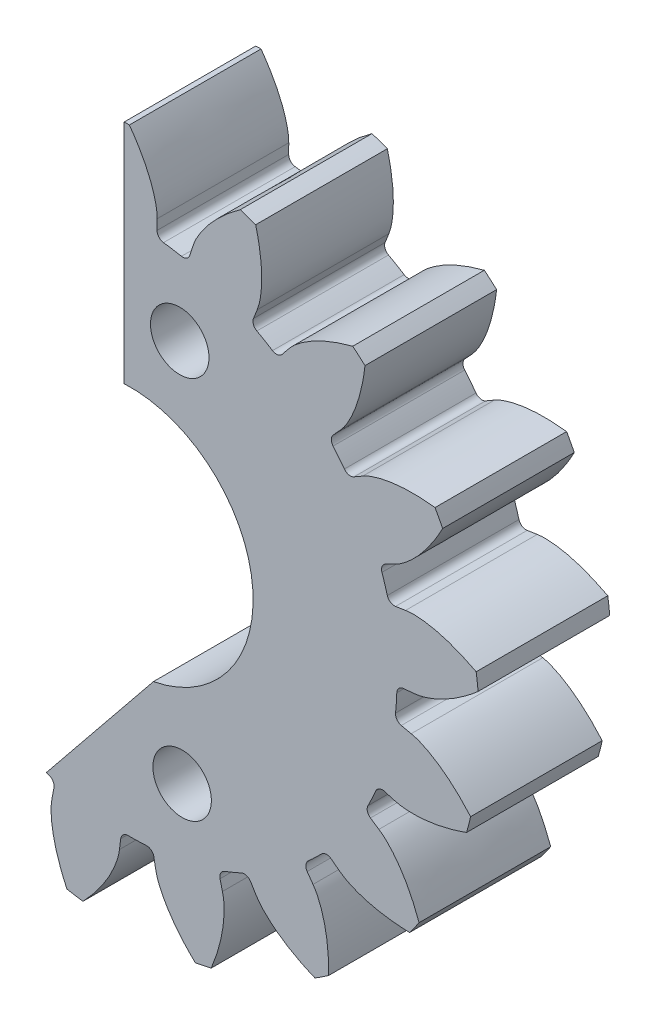
from build123d import *

# Parameters (mm, degrees)
SKETCH1_R           = 1.5
BOSS_EXTRUDE1_DEPTH = 4.5
CUT_EXTRUDE1_DEPTH  = 18.474286306
SKETCH5_R           = 1
CUT_EXTRUDE2_DEPTH  = 18.44524279


with BuildPart() as part:
    # Sketch1 → Boss-Extrude1 (new body)
    with BuildSketch(Plane.XY):
        with BuildLine():
            Line((2.142690816, 9.446385822), (2.036760212, 9.116523343))
            ThreePointArc((2.036760212, 9.116523343), (1.925215556, 8.976884922), (1.749077663, 8.946610489))
            ThreePointArc((1.749077663, 8.946610489), (1.443445404, 9.000976463), (1.136139278, 9.044904613))
            ThreePointArc((1.136139278, 9.044904613), (0.978300237, 9.128737399), (0.916012393, 9.296252542))
            Line((0.916012393, 9.296252542), (0.918538131, 9.642697586))
            add(Edge.make_bspline(
                [(0.918538131, 9.642697586), (0.920074647, 9.853455045), (0.756738592, 10.686258414), (0.336577813, 11.434986659), (-0.030409782, 11.94504001)],
                knots=[0, 0, 0, 0, 0.250058326, 1, 1, 1, 1], degree=3))
            ThreePointArc((-0.030409782, 11.94504001), (-0.308005832, 11.941107068), (-0.585435504, 11.93072382))
            add(Edge.make_bspline(
                [(-0.585435504, 11.93072382), (-0.924729077, 11.407724954), (-1.308534817, 10.639195503), (-1.429406641, 9.798416791), (-1.414428472, 9.582521648)],
                knots=[-0.008484668, -0.008484668, -0.008484668, -0.008484668, 0.741457006, 1, 1, 1, 1], degree=3))
            Line((-1.414428472, 9.582521648), (-1.394045746, 9.236667499))
            ThreePointArc((-1.394045746, 9.236667499), (-1.447614825, 9.066163972), (-1.600922132, 8.974305558))
            ThreePointArc((-1.600922132, 8.974305558), (-1.905554981, 8.914593212), (-2.207978087, 8.844543215))
            ThreePointArc((-2.207978087, 8.844543215), (-2.385442505, 8.865696922), (-2.50403764, 8.999399176))
            Line((-2.50403764, 8.999399176), (-2.626832843, 9.32336196))
            add(Edge.make_bspline(
                [(-2.626832843, 9.32336196), (-2.701534461, 9.520442492), (-3.154684073, 10.238004717), (-3.81694417, 10.784393433), (-4.343402434, 11.127432808)],
                knots=[0, 0, 0, 0, 0.250058326, 1, 1, 1, 1], degree=3))
            ThreePointArc((-4.343402434, 11.127432808), (-4.600832298, 11.023486189), (-4.855776901, 10.913584942))
            add(Edge.make_bspline(
                [(-4.855776901, 10.913584942), (-4.983229754, 10.303336047), (-5.063493088, 9.448057053), (-4.872478404, 8.620390313), (-4.780521357, 8.424484826)],
                knots=[-0.008484668, -0.008484668, -0.008484668, -0.008484668, 0.741457006, 1, 1, 1, 1], degree=3))
            Line((-4.780521357, 8.424484826), (-4.636578102, 8.109348527))
            ThreePointArc((-4.636578102, 8.109348527), (-4.624936802, 7.93100734), (-4.734708522, 7.789970933))
            ThreePointArc((-4.734708522, 7.789970933), (-4.997199607, 7.62424475), (-5.253895777, 7.449677247))
            ThreePointArc((-5.253895777, 7.449677247), (-5.427018018, 7.405294949), (-5.585903513, 7.487127083))
            Line((-5.585903513, 7.487127083), (-5.817435487, 7.74485464))
            add(Edge.make_bspline(
                [(-5.817435487, 7.74485464), (-5.95828637, 7.901641426), (-6.640049173, 8.407051753), (-7.454966693, 8.677308116), (-8.069794519, 8.807004146)],
                knots=[0, 0, 0, 0, 0.250058326, 1, 1, 1, 1], degree=3))
            ThreePointArc((-8.069794519, 8.807004146), (-8.272290869, 8.617082417), (-8.470318721, 8.422505943))
            add(Edge.make_bspline(
                [(-8.470318721, 8.422505943), (-8.368717639, 7.807424515), (-8.13459856, 6.980906144), (-7.65749496, 6.278132356), (-7.500978342, 6.128674647)],
                knots=[-0.008484668, -0.008484668, -0.008484668, -0.008484668, 0.741457006, 1, 1, 1, 1], degree=3))
            Line((-7.500978342, 6.128674647), (-7.252914893, 5.886817101))
            ThreePointArc((-7.252914893, 5.886817101), (-7.177635437, 5.724724219), (-7.22904629, 5.553557567))
            ThreePointArc((-7.22904629, 5.553557567), (-7.413944735, 5.304199787), (-7.59024573, 5.048691086))
            ThreePointArc((-7.59024573, 5.048691086), (-7.735644677, 4.944766859), (-7.913362165, 4.963676991))
            Line((-7.913362165, 4.963676991), (-8.222361232, 5.120361784))
            add(Edge.make_bspline(
                [(-8.222361232, 5.120361784), (-8.410338689, 5.2156799), (-9.228638839, 5.440679864), (-10.086154654, 5.398304255), (-10.706316137, 5.297140773)],
                knots=[0, 0, 0, 0, 0.250058326, 1, 1, 1, 1], degree=3))
            ThreePointArc((-10.706316137, 5.297140773), (-10.826530719, 5.046893916), (-10.940897062, 4.793920846))
            add(Edge.make_bspline(
                [(-10.940897062, 4.793920846), (-10.623963835, 4.25707704), (-10.107081422, 3.570945177), (-9.40832439, 3.087977836), (-9.208386639, 3.005152997)],
                knots=[-0.008484668, -0.008484668, -0.008484668, -0.008484668, 0.741457006, 1, 1, 1, 1], degree=3))
            Line((-9.208386639, 3.005152997), (-8.889705338, 2.869238405))
            ThreePointArc((-8.889705338, 2.869238405), (-8.760954633, 2.745285371), (-8.7470613, 2.567105479))
            ThreePointArc((-8.7470613, 2.567105479), (-8.829395545, 2.267793252), (-8.901490937, 1.965851218))
            ThreePointArc((-8.901490937, 1.965851218), (-8.999529656, 1.816420605), (-9.172077407, 1.769854816))
            Line((-9.172077407, 1.769854816), (-9.516811531, 1.804335697))
            add(Edge.make_bspline(
                [(-9.516811531, 1.804335697), (-9.726528165, 1.825311903), (-10.570849691, 1.739514011), (-11.35515154, 1.390229491), (-11.896890436, 1.071869186)],
                knots=[0, 0, 0, 0, 0.250058326, 1, 1, 1, 1], degree=3))
            ThreePointArc((-11.896890436, 1.071869186), (-11.918587603, 0.795094426), (-11.933846629, 0.517890175))
            add(Edge.make_bspline(
                [(-11.933846629, 0.517890175), (-11.444384845, 0.131787721), (-10.714546932, -0.321291723), (-9.888507478, -0.519225201), (-9.672151294, -0.524231217)],
                knots=[-0.008484668, -0.008484668, -0.008484668, -0.008484668, 0.741457006, 1, 1, 1, 1], degree=3))
            Line((-9.672151294, -0.524231217), (-9.325891817, -0.535846836))
            ThreePointArc((-9.325891817, -0.535846836), (-9.16105836, -0.604919479), (-9.083737211, -0.766048429))
            ThreePointArc((-9.083737211, -0.766048429), (-9.052387561, -1.074891329), (-9.010540469, -1.382487749))
            ThreePointArc((-9.010540469, -1.382487749), (-9.047978288, -1.557243317), (-9.19205277, -1.662996058))
            Line((-9.19205277, -1.662996058), (-9.525963699, -1.755375925))
            add(Edge.make_bspline(
                [(-9.525963699, -1.755375925), (-9.729096116, -1.811574581), (-10.485408718, -2.196582847), (-11.090572289, -2.805603469), (-11.480723759, -3.298164274)],
                knots=[0, 0, 0, 0, 0.250058326, 1, 1, 1, 1], degree=3))
            ThreePointArc((-11.480723759, -3.298164274), (-11.400973189, -3.564086973), (-11.315064081, -3.828084435))
            add(Edge.make_bspline(
                [(-11.315064081, -3.828084435), (-10.719178266, -4.01130026), (-9.874953507, -4.170136395), (-9.033192836, -4.056303998), (-8.829638322, -3.982815101)],
                knots=[-0.008484668, -0.008484668, -0.008484668, -0.008484668, 0.741457006, 1, 1, 1, 1], degree=3))
            Line((-8.829638322, -3.982815101), (-8.50256493, -3.868562992))
            ThreePointArc((-8.50256493, -3.868562992), (-8.323910392, -3.873426601), (-8.193604078, -3.995743252))
            ThreePointArc((-8.193604078, -3.995743252), (-8.052804476, -4.272405879), (-7.902666581, -4.544114086))
            ThreePointArc((-7.902666581, -4.544114086), (-7.874447315, -4.7205929), (-7.970590473, -4.8712501))
            Line((-7.970590473, -4.8712501), (-8.248581684, -5.078014301))
            add(Edge.make_bspline(
                [(-8.248581684, -5.078014301), (-8.417695725, -5.20379788), (-8.983855196, -5.836019021), (-9.328149796, -6.622524135), (-9.514021721, -7.222762373)],
                knots=[0, 0, 0, 0, 0.250058326, 1, 1, 1, 1], degree=3))
            ThreePointArc((-9.514021721, -7.222762373), (-9.34359417, -7.441918676), (-9.16811943, -7.657055029))
            add(Edge.make_bspline(
                [(-9.16811943, -7.657055029), (-8.546287266, -7.612639914), (-7.701692893, -7.45578104), (-6.957895448, -7.045556464), (-6.794633768, -6.903497736)],
                knots=[-0.008484668, -0.008484668, -0.008484668, -0.008484668, 0.741457006, 1, 1, 1, 1], degree=3))
            Line((-6.794633768, -6.903497736), (-6.530919535, -6.678808281))
            ThreePointArc((-6.530919535, -6.678808281), (-6.362572202, -6.618805997), (-6.196879311, -6.685790808))
            ThreePointArc((-6.196879311, -6.685790808), (-5.965645524, -6.892908341), (-5.727493781, -7.092032636))
            ThreePointArc((-5.727493781, -7.092032636), (-5.637428599, -7.246400254), (-5.672655765, -7.421614824))
            Line((-5.672655765, -7.421614824), (-5.857183005, -7.714838707))
            add(Edge.make_bspline(
                [(-5.857183005, -7.714838707), (-5.969438883, -7.893219439), (-6.268982248, -8.687268487), (-6.305908984, -9.545036219), (-6.26239833, -10.171886391)],
                knots=[0, 0, 0, 0, 0.250058326, 1, 1, 1, 1], degree=3))
            ThreePointArc((-6.26239833, -10.171886391), (-6.024310985, -10.314678025), (-5.782969448, -10.451897912))
            add(Edge.make_bspline(
                [(-5.782969448, -10.451897912), (-5.219172814, -10.185850364), (-4.488275976, -9.734481141), (-3.942895724, -9.083267488), (-3.841976273, -8.891824748)],
                knots=[-0.008484668, -0.008484668, -0.008484668, -0.008484668, 0.741457006, 1, 1, 1, 1], degree=3))
            Line((-3.841976273, -8.891824748), (-3.677237268, -8.587043502))
            ThreePointArc((-3.677237268, -8.587043502), (-3.541933379, -8.470278967), (-3.363231656, -8.472885267))
            ThreePointArc((-3.363231656, -8.472885267), (-3.072793087, -8.582485337), (-2.778791209, -8.682132879))
            ThreePointArc((-2.778791209, -8.682132879), (-2.639043912, -8.7935411), (-2.608597463, -8.969649341))
            Line((-2.608597463, -8.969649341), (-2.674739306, -9.309731396))
            add(Edge.make_bspline(
                [(-2.674739306, -9.309731396), (-2.714976241, -9.516617976), (-2.70744851, -10.365254206), (-2.432020221, -11.178438271), (-2.165003344, -11.747240788)],
                knots=[0, 0, 0, 0, 0.250058326, 1, 1, 1, 1], degree=3))
            ThreePointArc((-2.165003344, -11.747240788), (-1.891411218, -11.794382951), (-1.616797397, -11.835154067))
            add(Edge.make_bspline(
                [(-1.616797397, -11.835154067), (-1.187180152, -11.38340528), (-0.668692519, -10.698485624), (-0.395386084, -9.894232906), (-0.370438593, -9.679261556)],
                knots=[-0.008484668, -0.008484668, -0.008484668, -0.008484668, 0.741457006, 1, 1, 1, 1], degree=3))
            Line((-0.370438593, -9.679261556), (-0.326923731, -9.335550916))
            ThreePointArc((-0.326923731, -9.335550916), (-0.242936827, -9.177793828), (-0.075360929, -9.115669622))
            ThreePointArc((-0.075360929, -9.115669622), (0.235057082, -9.112950131), (0.545202514, -9.099662968))
            ThreePointArc((0.545202514, -9.099662968), (0.715758279, -9.153065494), (0.807766381, -9.306283012))
            Line((0.807766381, -9.306283012), (0.868942758, -9.647293274))
            add(Edge.make_bspline(
                [(0.868942758, -9.647293274), (0.906158986, -9.854744521), (1.219741152, -10.643354909), (1.770326349, -11.302130292), (2.22478734, -11.736065222)],
                knots=[0, 0, 0, 0, 0.250058326, 1, 1, 1, 1], degree=3))
            ThreePointArc((2.22478734, -11.736065222), (2.496934113, -11.681191105), (2.767732101, -11.620007083))
            add(Edge.make_bspline(
                [(2.767732101, -11.620007083), (3.005147767, -11.043568236), (3.241201568, -10.217600341), (3.205522637, -9.368927344), (3.151128871, -9.159460457)],
                knots=[-0.008484668, -0.008484668, -0.008484668, -0.008484668, 0.741457006, 1, 1, 1, 1], degree=3))
            Line((3.151128871, -9.159460457), (3.067542667, -8.823240448))
            ThreePointArc((3.067542667, -8.823240448), (3.08886969, -8.645796776), (3.222687709, -8.527332282))
            ThreePointArc((3.222687709, -8.527332282), (3.511161491, -8.412660513), (3.795563616, -8.288233151))
            ThreePointArc((3.795563616, -8.288233151), (3.973893348, -8.276417674), (4.115036899, -8.386051594))
            Line((4.115036899, -8.386051594), (4.295269287, -8.681934737))
            add(Edge.make_bspline(
                [(4.295269287, -8.681934737), (4.40491242, -8.861933212), (4.982198012, -9.484011554), (5.733580536, -9.899406991), (6.314108166, -10.139869016)],
                knots=[0, 0, 0, 0, 0.250058326, 1, 1, 1, 1], degree=3))
            ThreePointArc((6.314108166, -10.139869016), (6.548054657, -9.990389672), (6.778464043, -9.835513755))
            add(Edge.make_bspline(
                [(6.778464043, -9.835513755), (6.791613828, -9.212236107), (6.713353424, -8.356771514), (6.373507764, -7.578296229), (6.247118921, -7.402623469)],
                knots=[-0.008484668, -0.008484668, -0.008484668, -0.008484668, 0.741457006, 1, 1, 1, 1], degree=3))
            Line((6.247118921, -7.402623469), (6.047720431, -7.119302467))
            ThreePointArc((6.047720431, -7.119302467), (6.003507239, -6.946136961), (6.085494515, -6.787331466))
            ThreePointArc((6.085494515, -6.787331466), (6.313064084, -6.576194476), (6.53331282, -6.357431519))
            ThreePointArc((6.53331282, -6.357431519), (6.6953321, -6.281993786), (6.866548882, -6.33323744))
            Line((6.866548882, -6.33323744), (7.141495898, -6.544032806))
            add(Edge.make_bspline(
                [(7.141495898, -6.544032806), (7.308758024, -6.672268717), (8.071781424, -7.043799887), (8.9224829, -7.159713921), (9.550673697, -7.174227313)],
                knots=[0, 0, 0, 0, 0.250058326, 1, 1, 1, 1], degree=3))
            ThreePointArc((9.550673697, -7.174227313), (9.714824136, -6.950330756), (9.873726855, -6.722679793))
            add(Edge.make_bspline(
                [(9.873726855, -6.722679793), (9.660834808, -6.136740445), (9.278829699, -5.367314387), (8.68071535, -4.764174216), (8.499400943, -4.646021162)],
                knots=[-0.008484668, -0.008484668, -0.008484668, -0.008484668, 0.741457006, 1, 1, 1, 1], degree=3))
            Line((8.499400943, -4.646021162), (8.211120038, -4.453863238))
            ThreePointArc((8.211120038, -4.453863238), (8.107337868, -4.30836286), (8.126421565, -4.130663926))
            ThreePointArc((8.126421565, -4.130663926), (8.262352391, -3.851576936), (8.388701925, -3.568023533))
            ThreePointArc((8.388701925, -3.568023533), (8.512529152, -3.439151827), (8.69069539, -3.425084476))
            Line((8.69069539, -3.425084476), (9.023223916, -3.522322983))
            add(Edge.make_bspline(
                [(9.023223916, -3.522322983), (9.225515358, -3.58147736), (10.071226027, -3.652284013), (10.906354508, -3.453061812), (11.497367823, -3.239666457)],
                knots=[0, 0, 0, 0, 0.250058326, 1, 1, 1, 1], degree=3))
            ThreePointArc((11.497367823, -3.239666457), (11.569552783, -2.971591157), (11.635488142, -2.701910674))
            add(Edge.make_bspline(
                [(11.635488142, -2.701910674), (11.225306515, -2.232443981), (10.591148608, -1.652971712), (9.815544227, -1.306624075), (9.603791772, -1.261947952)],
                knots=[-0.008484668, -0.008484668, -0.008484668, -0.008484668, 0.741457006, 1, 1, 1, 1], degree=3))
            Line((9.603791772, -1.261947952), (9.265562385, -1.186905099))
            ThreePointArc((9.265562385, -1.186905099), (9.116227595, -1.088720481), (9.069830353, -0.916127333))
            ThreePointArc((9.069830353, -0.916127333), (9.095764224, -0.606782588), (9.111150352, -0.296734198))
            ThreePointArc((9.111150352, -0.296734198), (9.180061972, -0.131833357), (9.341115328, -0.054354874))
            Line((9.341115328, -0.054354874), (9.686315544, -0.024903923))
            add(Edge.make_bspline(
                [(9.686315544, -0.024903923), (9.896315722, -0.006987639), (10.710495748, 0.232493054), (11.417262505, 0.719945428), (11.891278715, 1.132429305)],
                knots=[0, 0, 0, 0, 0.250058326, 1, 1, 1, 1], degree=3))
            ThreePointArc((11.891278715, 1.132429305), (11.861749218, 1.408478293), (11.825812282, 1.683766454))
            add(Edge.make_bspline(
                [(11.825812282, 1.683766454), (11.273738375, 1.973356413), (10.47307421, 2.284613953), (9.624729466, 2.327392886), (9.411137305, 2.292558321)],
                knots=[-0.008484668, -0.008484668, -0.008484668, -0.008484668, 0.741457006, 1, 1, 1, 1], degree=3))
            Line((9.411137305, 2.292558321), (9.068639189, 2.24035115))
            ThreePointArc((9.068639189, 2.24035115), (8.89392027, 2.277959631), (8.788308294, 2.422137332))
            ThreePointArc((8.788308294, 2.422137332), (8.700742697, 2.719961111), (8.603087437, 3.014630735))
            ThreePointArc((8.603087437, 3.014630735), (8.607776555, 3.193289938), (8.72996588, 3.323715655))
            Line((8.72996588, 3.323715655), (9.041216585, 3.47587855))
            add(Edge.make_bspline(
                [(9.041216585, 3.47587855), (9.23056381, 3.568445801), (9.90325367, 4.085870646), (10.386205936, 4.795720049), (10.679206525, 5.351584215)],
                knots=[0, 0, 0, 0, 0.250058326, 1, 1, 1, 1], degree=3))
            ThreePointArc((10.679206525, 5.351584215), (10.551950692, 5.598324945), (10.418994944, 5.842041592))
            add(Edge.make_bspline(
                [(10.418994944, 5.842041592), (9.799589398, 5.912644088), (8.940553107, 5.913649844), (8.134041659, 5.647082543), (7.947456596, 5.537441889)],
                knots=[-0.008484668, -0.008484668, -0.008484668, -0.008484668, 0.741457006, 1, 1, 1, 1], degree=3))
            Line((7.947456596, 5.537441889), (7.64694602, 5.365035562))
            ThreePointArc((7.64694602, 5.365035562), (7.470439729, 5.336988673), (7.319876502, 5.433278929))
            ThreePointArc((7.319876502, 5.433278929), (7.130637656, 5.67935899), (6.933129893, 5.918853082))
            ThreePointArc((6.933129893, 5.918853082), (6.872963217, 6.087141733), (6.939786166, 6.252899967))
            Line((6.939786166, 6.252899967), (7.175051226, 6.507224364))
            add(Edge.make_bspline(
                [(7.175051226, 6.507224364), (7.318173108, 6.661940862), (7.758522308, 7.387428767), (7.952434703, 8.223806103), (8.024848318, 8.847978022)],
                knots=[0, 0, 0, 0, 0.250058326, 1, 1, 1, 1], degree=3))
            ThreePointArc((8.024848318, 8.847978022), (7.817052756, 9.032086792), (7.605034605, 9.211316641))
            add(Edge.make_bspline(
                [(7.605034605, 9.211316641), (7.001951571, 9.053396417), (6.200560765, 8.744014555), (5.544806453, 8.20410241), (5.410427836, 8.034463247)],
                knots=[-0.008484668, -0.008484668, -0.008484668, -0.008484668, 0.741457006, 1, 1, 1, 1], degree=3))
            Line((5.410427836, 8.034463247), (5.192490418, 7.765142193))
            ThreePointArc((5.192490418, 7.765142193), (5.038034908, 7.675227821), (4.862854828, 7.710626099))
            ThreePointArc((4.862854828, 7.710626099), (4.597500488, 7.871727967), (4.326814738, 8.023701524))
            ThreePointArc((4.326814738, 8.023701524), (4.209918111, 8.158891306), (4.212349875, 8.33759549))
            Line((4.212349875, 8.33759549), (4.339855442, 8.65973347))
            add(Edge.make_bspline(
                [(4.339855442, 8.65973347), (4.417422576, 8.855703895), (4.565959517, 9.691273698), (4.444643097, 10.541221574), (4.286689878, 11.149403369)],
                knots=[0, 0, 0, 0, 0.250058326, 1, 1, 1, 1], degree=3))
            ThreePointArc((4.286689878, 11.149403369), (4.026418528, 11.246015269), (3.763972202, 11.336552336))
            add(Edge.make_bspline(
                [(3.763972202, 11.336552336), (3.258661385, 10.971437393), (2.623148333, 10.393451648), (2.206714411, 9.653112786), (2.142690816, 9.446385822)],
                knots=[-0.008484668, -0.008484668, -0.008484668, -0.008484668, 0.741457006, 1, 1, 1, 1], degree=3))
        make_face()
        Circle(SKETCH1_R, mode=Mode.SUBTRACT)
    extrude(amount=BOSS_EXTRUDE1_DEPTH)

    # Sketch4 → Cut-Extrude1 (cut, through all)
    with BuildSketch(Plane(origin=(0, 0, 0), x_dir=(-1, 0, 0), z_dir=(0, 0, -1))):
        with BuildLine():
            Line((12.86321323, 15.189801976), (0.209946094, 15.189801976))
            Line((0.209946094, 15.189801976), (0.209946094, 4.194749413))
            ThreePointArc((0.209946094, 4.194749413), (-4.169900225, 0.501928397), (-0.791467324, -4.12475205))
            Line((-0.791467324, -4.12475205), (2.872793087, -8.653266145))
            Line((2.872793087, -8.653266145), (2.872793087, -14.49172888))
            Line((2.872793087, -14.49172888), (12.86321323, -14.49172888))
            Line((12.86321323, -14.49172888), (12.86321323, 15.189801976))
        make_face()
    extrude(amount=-CUT_EXTRUDE1_DEPTH, mode=Mode.SUBTRACT)

    # Sketch5 → Cut-Extrude2 (cut, through all)
    with BuildSketch(Plane.XY.offset(4.5)):
        with Locations((1.690053906, 6.412399978)):
            Circle(SKETCH5_R)
        with Locations((1.772781001, -6.658395059)):
            Circle(SKETCH5_R)
    extrude(amount=-CUT_EXTRUDE2_DEPTH, mode=Mode.SUBTRACT)


solid = part.part
